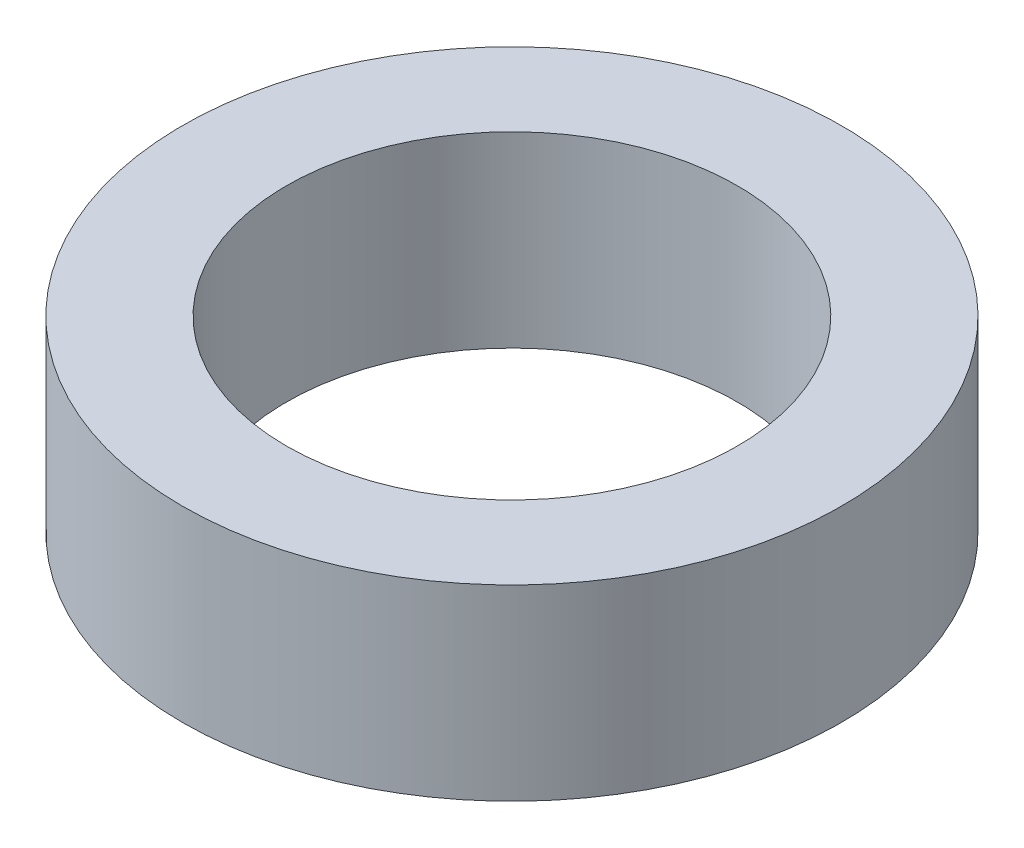
from build123d import *

# Parameters (mm, degrees)
SKETCH1_R           = 47.5
BOSS_EXTRUDE1_DEPTH = 27
SKETCH2_R           = 32.5
CUT_EXTRUDE1_DEPTH  = 73.398204398


with BuildPart() as part:
    # Sketch1 → Boss-Extrude1 (new body)
    with BuildSketch(Plane(origin=(0, 0, 0), x_dir=(1, 0, 0), z_dir=(0, 1, 0))):
        Circle(SKETCH1_R)
    extrude(amount=BOSS_EXTRUDE1_DEPTH)

    # Sketch2 → Cut-Extrude1 (cut, through all)
    with BuildSketch(Plane(origin=(0, 0, 0), x_dir=(1, 0, 0), z_dir=(0, 1, 0))):
        Circle(SKETCH2_R)
    extrude(amount=CUT_EXTRUDE1_DEPTH, mode=Mode.SUBTRACT)


solid = part.part
